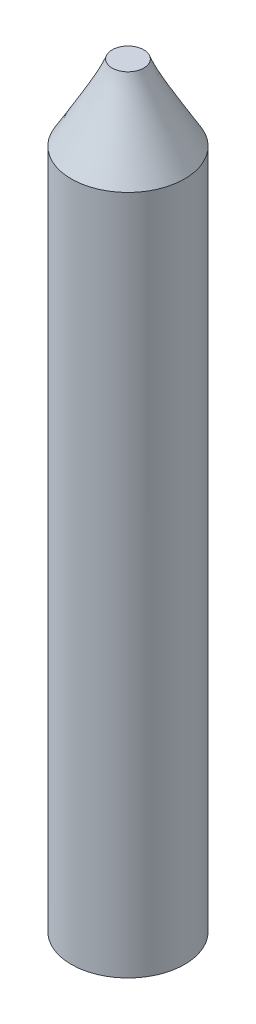
from build123d import *

# Parameters (mm, degrees)
SKETCH2_R           = 9.525
BOSS_EXTRUDE1_DEPTH = 114.3


with BuildPart() as part:
    # Sketch2 → Boss-Extrude1 (new body)
    with BuildSketch(Plane(origin=(0, 0, 0), x_dir=(1, 0, 0), z_dir=(0, 1, 0))):
        with Locations(Location((0, 0, 0), (0, 0, 270))):
            Circle(SKETCH2_R)
    extrude(amount=BOSS_EXTRUDE1_DEPTH)

    # Loft1: read off the stored shape, not the designer's step
    # Loft1: loft between two sections, ruled curve by curve
    loft1_from = [
        Edge.make_bspline([(0.303276571, 127, -2.640515625), (5.584307822, 127, -2.033962484), (4.97775468, 127, 3.247068767), (-0.303276571, 127, 2.640515625), (-5.584307822, 127, 2.033962484), (-4.97775468, 127, -3.247068767), (0.303276571, 127, -2.640515625)], [0, 0, 0, 0, 0.5, 0.5, 0.5, 1, 1, 1, 1], 3, [1, 0.333333333, 0.333333333, 1, 0.333333333, 0.333333333, 1]),
    ]
    loft1_to = [
        Edge.make_bspline([(-5.343940235, 114.3, -7.884664087), (10.425387939, 114.3, -18.572544557), (21.113268409, 114.3, -2.803216383), (5.343940235, 114.3, 7.884664087), (-10.425387939, 114.3, 18.572544557), (-21.113268409, 114.3, 2.803216383), (-5.343940235, 114.3, -7.884664087)], [0, 0, 0, 0, 0.5, 0.5, 0.5, 1, 1, 1, 1], 3, [1, 0.333333333, 0.333333333, 1, 0.333333333, 0.333333333, 1]),
    ]
    loft1 = Solid(Shell([*[Face.make_surface_from_curves(loft1_from[k], loft1_to[k]) for k in range(1)], Face(Wire(loft1_from)), Face(Wire(loft1_to))]))
    add(loft1)


solid = part.part
